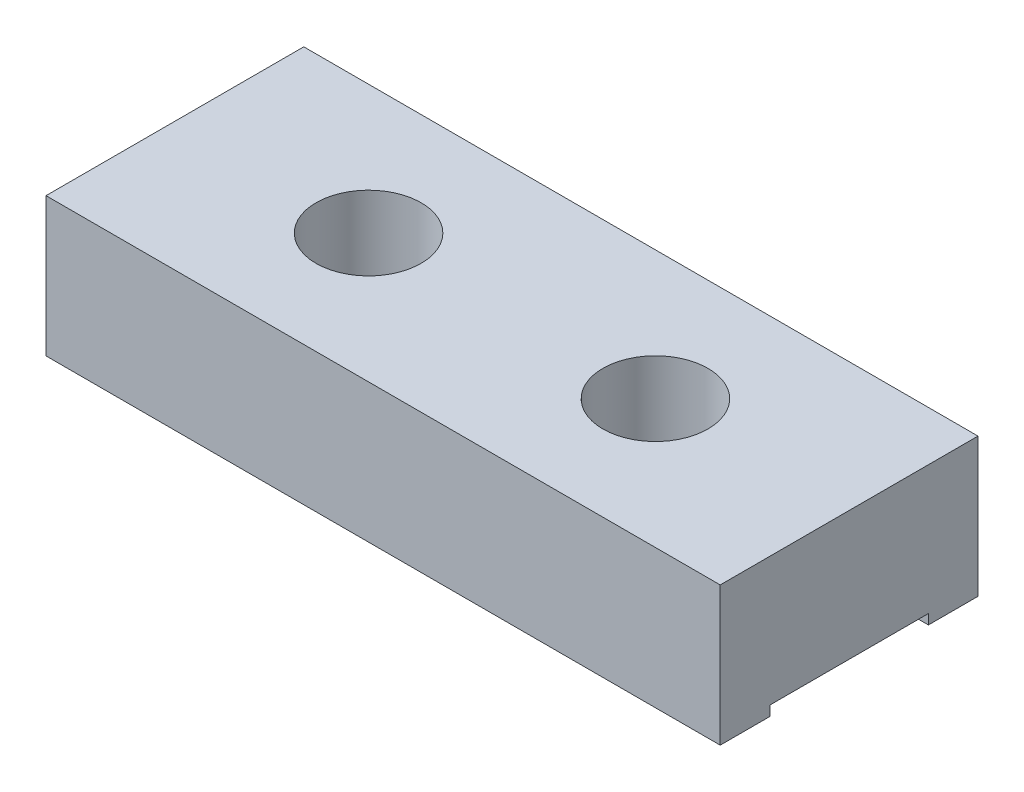
from build123d import *

# Parameters (mm, degrees)
BOSS_EXTRUDE1_DEPTH             = 16
SKETCH2_W                       = 34
SKETCH2_H                       = 8
CUT_EXTRUDE1_DEPTH              = 0.5
SKETCH7_R                       = 8.5
CUT_EXTRUDE2_DEPTH              = 2
BOSS_EXTRUDE2_DEPTH             = 3
BOSS_EXTRUDE3_REACH             = 31.159
BOSS_EXTRUDE3_DIRECTION_2_REACH = 31.159
SKETCH11_W                      = 2.65
SKETCH11_H                      = 24
M5_CLEARANCE_HOLE2_AT_2_COUNT   = 2
M5_CLEARANCE_HOLE2_AT_2_PITCH   = 25.394250395
M5_CLEARANCE_HOLE2_AT_3_COUNT   = 2
M5_CLEARANCE_HOLE2_AT_3_PITCH   = 19.596880573
M5_CLEARANCE_HOLE2_AT_4_COUNT   = 2
M5_CLEARANCE_HOLE2_AT_4_PITCH   = 14.465476141
MOVE_FACE1_BY                   = 0.5
FILLET1_R                       = 0.4
CHAMFER1_SIZE                   = 0.6
FILLET2_R                       = 0.2


# Read off the part's stored shape, not the designer's step: M4 Tapped Hole2
with BuildPart() as part:
    # Sketch1 → Boss-Extrude1 (new body)
    with BuildSketch(Plane(origin=(0, -16.5, 0), x_dir=(-1, 0, 0), z_dir=(0, -1, 0))):
        with BuildLine():
            Line((17, -17), (-17, -17))
            Line((-17, -17), (-17, 0))
            ThreePointArc((-17, 0), (0, 17), (17, 0))
            Line((17, 0), (17, -17))
        make_face()
    extrude(amount=-BOSS_EXTRUDE1_DEPTH)

    # Sketch2 → Cut-Extrude1 (cut)
    with BuildSketch(Plane(origin=(0, -0.5, 0), x_dir=(1, 0, 0), z_dir=(0, 1, 0))):
        with Locations((0, -10.5)):
            Rectangle(SKETCH2_W, SKETCH2_H)
    extrude(amount=-CUT_EXTRUDE1_DEPTH, mode=Mode.SUBTRACT)

    # Sketch7 → Cut-Extrude2 (cut)
    with BuildSketch(Plane.XZ.offset(16.5)):
        with Locations(Location((0, 0, 0), (0, 0, 270))):
            Circle(SKETCH7_R)
    extrude(amount=-CUT_EXTRUDE2_DEPTH, mode=Mode.SUBTRACT)

    # Sketch8 → Boss-Extrude2 (add)
    with BuildSketch(Plane(origin=(0, -0.5, 0), x_dir=(1, 0, 0), z_dir=(0, 1, 0))):
        with BuildLine():
            Line((-17, -4), (17, -4))
            Line((17, -4), (17, 0))
            ThreePointArc((17, 0), (0, 17), (-17, 0))
            Line((-17, 0), (-17, -4))
        make_face()
    extrude(amount=BOSS_EXTRUDE2_DEPTH)


with BuildPart() as body_2:

    # Boss-Extrude3: up to this face of the body (flat: up to its plane)
    boss_extrude3_end = Plane(part.part.faces().sort_by_distance((17, -8.203571429, 8.192857143))[0])
    # Sketch9 → Boss-Extrude3 (new, up to the picked face)
    with BuildSketch(Plane(origin=(0, 0, 0), x_dir=(0, 0, -1), z_dir=(1, 0, 0)), mode=Mode.PRIVATE) as boss_extrude3_sk1:
        Polygon((-14.5, 1), (-14.5, 0.5), (-17, 0.5), (-17, 7.5), (-4, 7.5), (-4, 0.5), (-6.5, 0.5), (-6.5, 1), align=None)
    boss_extrude3_tool1 = split(extrude(boss_extrude3_sk1.sketch, amount=BOSS_EXTRUDE3_REACH, mode=Mode.PRIVATE), bisect_by=boss_extrude3_end, keep=Keep.BOTH, mode=Mode.PRIVATE)
    add(boss_extrude3_tool1.solids().sort_by(Axis((0, 4.149425, 10.5), (1, 0, 0)))[0])


    # Boss-Extrude3 direction 2: up to this face of the body (flat: up to its plane)
    boss_extrude3_direction_2_end = Plane(part.part.faces().sort_by_distance((-17, -8.203571429, 8.192857143))[0])
    # Sketch9 → Boss-Extrude3 direction 2 (add, up to the picked face)
    with BuildSketch(Plane(origin=(0, 0, 0), x_dir=(0, 0, -1), z_dir=(1, 0, 0)), mode=Mode.PRIVATE) as boss_extrude3_direction_2_sk1:
        Polygon((-14.5, 1), (-14.5, 0.5), (-17, 0.5), (-17, 7.5), (-4, 7.5), (-4, 0.5), (-6.5, 0.5), (-6.5, 1), align=None)
    boss_extrude3_direction_2_tool1 = split(extrude(boss_extrude3_direction_2_sk1.sketch, amount=-BOSS_EXTRUDE3_DIRECTION_2_REACH, mode=Mode.PRIVATE), bisect_by=boss_extrude3_direction_2_end, keep=Keep.BOTH, mode=Mode.PRIVATE)
    add(boss_extrude3_direction_2_tool1.solids().sort_by(Axis((0, 4.149425, 10.5), (-1, 0, 0)))[0])


with BuildPart() as m5_clearance_hole2_tool:
    # Sketch11 → M5 Clearance Hole2 (revolve)
    with BuildSketch(Plane(origin=(7.232738071, 7.5, 10.5), x_dir=(0, 0, 1), z_dir=(1, 0, 0))):
        with Locations((1.325, 12)):
            Rectangle(SKETCH11_W, SKETCH11_H)
    m5_clearance_hole2 = revolve(axis=Axis((7.232738071, 13.85, 10.5), (0, -1, 0)))


with BuildPart() as part_1:
    add(part.part)

    # M5 Clearance Hole2: cut by m5_clearance_hole2_tool
    add(m5_clearance_hole2_tool.part, mode=Mode.SUBTRACT)

    # M5 Clearance Hole2 at 2: M5 Clearance Hole2 ×2
    with Locations(*[Vector(-0.6398436369623559, 0, -0.768505120502645) * (i * M5_CLEARANCE_HOLE2_AT_2_PITCH) for i in range(1, M5_CLEARANCE_HOLE2_AT_2_COUNT)]):
        add(m5_clearance_hole2, mode=Mode.SUBTRACT)

    # M5 Clearance Hole2 at 3: M5 Clearance Hole2 ×2
    with Locations(*[Vector(0.09097740748886189, 0, -0.9958529566791503) * (i * M5_CLEARANCE_HOLE2_AT_3_PITCH) for i in range(1, M5_CLEARANCE_HOLE2_AT_3_COUNT)]):
        add(m5_clearance_hole2, mode=Mode.SUBTRACT)


with BuildPart() as body_2_1:
    add(body_2.part)

    # M5 Clearance Hole2: cut by m5_clearance_hole2_tool
    add(m5_clearance_hole2_tool.part, mode=Mode.SUBTRACT)


with BuildPart() as m5_clearance_hole2_at_4_tool:
    # M5 Clearance Hole2 at 4: M5 Clearance Hole2 ×2
    with Locations(*[(-i * M5_CLEARANCE_HOLE2_AT_4_PITCH, 0, 0) for i in range(1, M5_CLEARANCE_HOLE2_AT_4_COUNT)]):
        add(m5_clearance_hole2)


with BuildPart() as part_2:
    add(part_1.part)

    # M5 Clearance Hole2 at 4: cut by m5_clearance_hole2_at_4_tool
    add(m5_clearance_hole2_at_4_tool.part, mode=Mode.SUBTRACT)

    # M4 Tapped Hole2 outline → M4 Tapped Hole2 (revolve, cut)
    with BuildSketch(Plane(origin=(0, -3.5, 5), x_dir=(0, 1, 0), z_dir=(0, 0, -1))):
        Polygon((0, 17), (0, 5.908579979), (1.65, 6.9), (1.65, 17), align=None)
        Polygon((1.65, -6.9), (0, -5.908579979), (0, -17), (1.65, -17), align=None)
    revolve(axis=Axis((0, -3.5, 5), (1, 0, 0)), mode=Mode.SUBTRACT)

    # M4 Tapped Hole2 2 outline → M4 Tapped Hole2 2 (revolve, cut)
    with BuildSketch(Plane(origin=(0, -11.5, 5), x_dir=(0, 1, 0), z_dir=(0, 0, -1))):
        Polygon((0, 17), (0, 5.908579979), (1.65, 6.9), (1.65, 17), align=None)
        Polygon((1.65, -6.9), (0, -5.908579979), (0, -17), (1.65, -17), align=None)
    revolve(axis=Axis((0, -11.5, 5), (1, 0, 0)), mode=Mode.SUBTRACT)

    # Move Face1: a face moved inward by 0.5
    extrude(part_2.faces().sort_by_distance((0, -14.5, 0))[0], amount=MOVE_FACE1_BY, dir=(0, 1, 0), mode=Mode.SUBTRACT)

    # Fillet1
    fillet1_edges = [part_2.edges().sort_by_distance(p)[0] for p in [
        (0, -14, 8.5),
    ]]
    fillet(fillet1_edges, radius=FILLET1_R)

    # Chamfer1
    chamfer1_edges = [part_2.edges().sort_by_distance(p)[0] for p in [
        (0, -16.5, 8.5),
    ]]
    chamfer(chamfer1_edges, length=CHAMFER1_SIZE)

    # Fillet2
    fillet2_edges = [part_2.edges().sort_by_distance(p)[0] for p in [
        (0, -0.5, 4),
    ]]
    fillet(fillet2_edges, radius=FILLET2_R)


with BuildPart() as body_2_2:
    add(body_2_1.part)

    # M5 Clearance Hole2 at 4: cut by m5_clearance_hole2_at_4_tool
    add(m5_clearance_hole2_at_4_tool.part, mode=Mode.SUBTRACT)


solid = body_2_2.part
